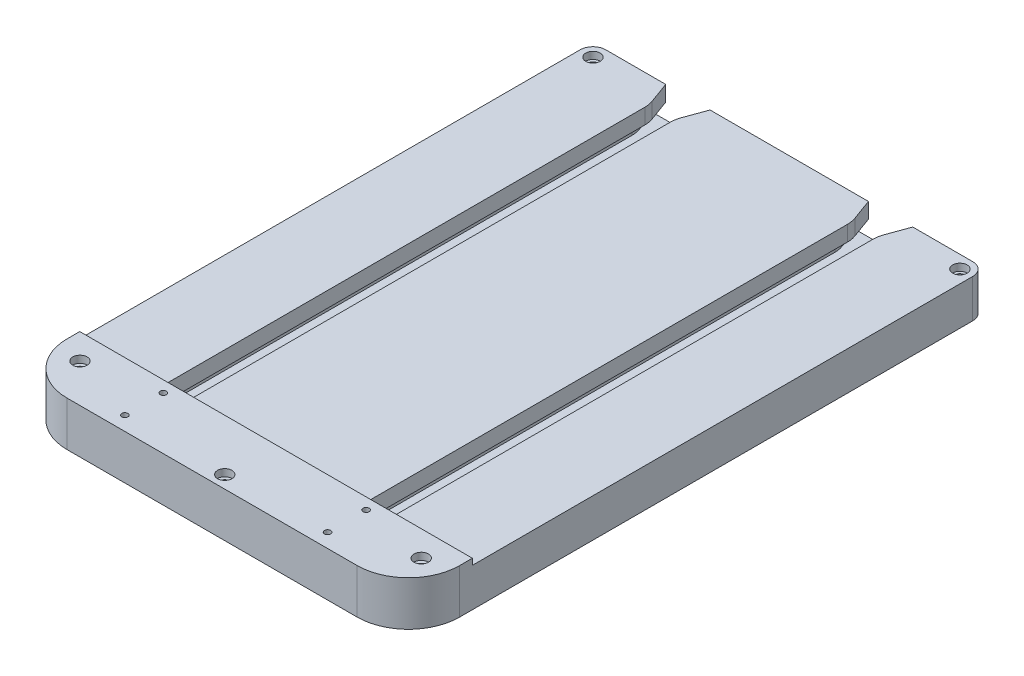
from build123d import *
from OCP.BRepFilletAPI import BRepFilletAPI_MakeChamfer

# Parameters (mm, degrees)
BOSS_EXTRUDE1_DEPTH                            = 254
SKETCH2_W                                      = 194.31
SKETCH2_H                                      = 44.45
SKETCH2_W_2                                    = 35.56
SKETCH2_H_2                                    = 17.018
BOSS_EXTRUDE2_DEPTH                            = 6.35
BOSS_EXTRUDE3_DEPTH                            = 44.45
CUT_EXTRUDE1_DEPTH                             = 324.390875065
CUT_EXTRUDE1_DEPTH_BACK                        = 324.390875065
SKETCH5_R                                      = 1.524
FILLET1_R                                      = 3.175
FILLET2_R                                      = 3.175
CBORE_FOR_6_SOCKET_HEAD_CAP_SCREW1_D           = 4.3053
CBORE_FOR_6_SOCKET_HEAD_CAP_SCREW1_CBORE_D     = 7.14502
CBORE_FOR_6_SOCKET_HEAD_CAP_SCREW1_CBORE_DEPTH = 3.5052
CHAMFER1_SIZE                                  = 12.7
CHAMFER1_SIZE2                                 = 4.622421975
FILLET4_R                                      = 12.7
FILLET6_R                                      = 6.35
FILLET7_R                                      = 2.54
CUT_EXTRUDE2_DEPTH                             = 363.564005121
SKETCH13_W                                     = 19.143193239
SKETCH13_H                                     = 43.092698141
CUT_EXTRUDE3_DEPTH                             = 362.835089653
FILLET8_R                                      = 25.4
CBORE_FOR_6_SOCKET_HEAD_CAP_SCREW3_D           = 3.6576
CBORE_FOR_6_SOCKET_HEAD_CAP_SCREW3_CBORE_D     = 7.14502
CBORE_FOR_6_SOCKET_HEAD_CAP_SCREW3_CBORE_DEPTH = 3.5052
CBORE_FOR_6_SOCKET_HEAD_CAP_SCREW4_D           = 3.6576
CBORE_FOR_6_SOCKET_HEAD_CAP_SCREW4_CBORE_D     = 7.14502
CBORE_FOR_6_SOCKET_HEAD_CAP_SCREW4_CBORE_DEPTH = 3.5052


with BuildPart() as part:
    # Sketch1 → Boss-Extrude1 (new body)
    with BuildSketch(Plane.XY):
        Polygon((-88.579180599, 2.764546242), (-47.939180599, 2.764546242), (-47.939180599, -4.855453758), (-54.289180599, -4.855453758), (-54.289180599, -12.475453758), (-28.889180599, -12.475453758), (-28.889180599, -4.855453758), (-35.239180599, -4.855453758), (-35.239180599, 2.764546242), (5.400819401, 2.764546242), (5.400819401, 28.164546242), (11.750819401, 28.164546242), (11.750819401, 2.764546242), (52.390819401, 2.764546242), (52.390819401, -4.855453758), (46.040819401, -4.855453758), (46.040819401, -12.475453758), (71.440819401, -12.475453758), (71.440819401, -4.855453758), (65.090819401, -4.855453758), (65.090819401, 2.764546242), (105.730819401, 2.764546242), (105.730819401, -16.285453758), (-88.579180599, -16.285453758), align=None)
    extrude(amount=BOSS_EXTRUDE1_DEPTH)

    # Sketch2 → Boss-Extrude2 (add)
    with BuildSketch(Plane.XY.offset(254)):
        with Locations((8.575819401, 5.939546242)):
            Rectangle(SKETCH2_W, SKETCH2_H)
        with Locations((-41.589180599, 14.321546242)):
            Rectangle(SKETCH2_W_2, SKETCH2_H_2, mode=Mode.SUBTRACT)
        with Locations((58.740819401, 14.321546242)):
            Rectangle(SKETCH2_W_2, SKETCH2_H_2, mode=Mode.SUBTRACT)
    extrude(amount=BOSS_EXTRUDE2_DEPTH)

    # Sketch3 → Boss-Extrude3 (add)
    with BuildSketch(Plane.XY.offset(260.35)):
        Polygon((-88.579180599, 5.812546242), (-88.579180599, -16.285453758), (105.730819401, -16.285453758), (105.730819401, 5.812546242), (76.520819401, 5.812546242), (40.960819401, 5.812546242), (-23.809180599, 5.812546242), (-59.369180599, 5.812546242), align=None)
    extrude(amount=BOSS_EXTRUDE3_DEPTH)

    # Sketch5 → Cut-Extrude1 (cut, two sides: drawn at the far end of the back side and taken through both)
    with BuildSketch(Plane(origin=(0, 5.812546242, 0), x_dir=(1, 0, 0), z_dir=(0, 1, 0)).offset(-CUT_EXTRUDE1_DEPTH_BACK)):
        with Locations(Location((-41.589180599, -259.614, 0), (0, 0, 180))):
            Circle(SKETCH5_R)
        with Locations(Location((-41.589180599, -278.664, 0), (0, 0, 180))):
            Circle(SKETCH5_R)
        with Locations(Location((58.740819401, -259.614, 0), (0, 0, 180))):
            Circle(SKETCH5_R)
        with Locations(Location((58.740819401, -278.664, 0), (0, 0, 180))):
            Circle(SKETCH5_R)
    extrude(amount=CUT_EXTRUDE1_DEPTH + CUT_EXTRUDE1_DEPTH_BACK, mode=Mode.SUBTRACT)

    # Fillet1
    # the kernel refuses this fillet: 3.175 mm, written as the material it takes off along each edge
    with BuildSketch(Plane(origin=(5.400819401, 28.164546242, -7.9375), x_dir=(0, -1, 0), z_dir=(0, 0, 1))) as fillet1_piece_1:
        with BuildLine():
            CenterArc((FILLET1_R, FILLET1_R), FILLET1_R, 180, 90)
            Line((0, FILLET1_R), (0, 0))
            Line((0, 0), (FILLET1_R, 0))
        make_face()
    extrude(amount=261.9375, mode=Mode.SUBTRACT)
    with BuildSketch(Plane(origin=(11.750819401, 28.164546242, -7.9375), x_dir=(0, -1, 0), z_dir=(0, 0, 1))) as fillet1_piece_2:
        with BuildLine():
            CenterArc((FILLET1_R, -FILLET1_R), FILLET1_R, 90, 90)
            Line((0, -FILLET1_R), (0, 0))
            Line((0, 0), (FILLET1_R, 0))
        make_face()
    extrude(amount=261.9375, mode=Mode.SUBTRACT)

    # Fillet2
    # the kernel refuses this fillet: 3.175 mm, written as the material it adds along each edge
    # the kernel refuses this fillet: 3.175 mm, written as the material it takes off along each edge
    with BuildSketch(Plane(origin=(65.343823241, 28.164546242, 260.35), x_dir=(0, -1, 0), z_dir=(-1, 0, 0))) as fillet2_2_piece_1:
        with BuildLine():
            CenterArc((FILLET2_R, -FILLET2_R), FILLET2_R, 90, 90)
            Line((0, -FILLET2_R), (0, 0))
            Line((0, 0), (FILLET2_R, 0))
        make_face()
    extrude(amount=113.536007681, mode=Mode.SUBTRACT)
    with BuildSketch(Plane(origin=(113.668319401, 28.164546242, 260.35), x_dir=(0, -1, 0), z_dir=(-1, 0, 0)), Plane(origin=(-34.986176759, 28.164546242, 260.35), x_dir=(0, -1, 0), z_dir=(-1, 0, 0))) as fillet2_2_piece_2:
        with BuildLine():
            CenterArc((FILLET2_R, -FILLET2_R), FILLET2_R, 90, 90)
            Line((0, -FILLET2_R), (0, 0))
            Line((0, 0), (FILLET2_R, 0))
        make_face()
    extrude(amount=61.53050384, mode=Mode.SUBTRACT)
    with BuildSketch(Plane(origin=(-96.516680599, 28.164546242, 254), x_dir=(0, -1, 0), z_dir=(1, 0, 0))) as fillet2_2_piece_3_section:
        with BuildLine():
            CenterArc((FILLET2_R, -FILLET2_R), FILLET2_R, 90, 90)
            Line((0, -FILLET2_R), (0, 0))
            Line((0, 0), (FILLET2_R, 0))
        make_face()
    fillet2_2_piece_3 = extrude(amount=105.0925, mode=Mode.PRIVATE)
    fillet2_2_piece_3 = fillet2_2_piece_3 - Plane(origin=(8.575819401, 24.989546242, 254.709193206), x_dir=(0, -1, 0), z_dir=(0, 0, -1)) * Cylinder(3.175, 223, mode=Mode.PRIVATE)
    add(fillet2_2_piece_3, mode=Mode.SUBTRACT)

    # CBORE for #6 Socket Head Cap Screw1 (through all)
    with Locations(Plane(origin=(0, 2.764546242, 0), x_dir=(1, 0, 0), z_dir=(0, 1, 0))):
        with Locations((99.380819401, -6.35), (-82.229180599, -6.35)):
            CounterBoreHole(CBORE_FOR_6_SOCKET_HEAD_CAP_SCREW1_D / 2, CBORE_FOR_6_SOCKET_HEAD_CAP_SCREW1_CBORE_D / 2, CBORE_FOR_6_SOCKET_HEAD_CAP_SCREW1_CBORE_DEPTH)

    # Chamfer1: one chamfer whose edges measure the first distance from different faces: ONE call of the kernel's chamfer builder (chamfer() names one face for all edges)
    chamfer1_edges_1 = [part.edges().sort_by_distance(p)[0] for p in [
        (-47.939180599, -1.045453758, 0),
    ]]
    chamfer1_side_1 = [part.faces().sort_by_distance(p)[0] for p in [
        (-47.939180599, -1.045453758, 127),
    ]]
    chamfer1_edges_2 = [part.edges().sort_by_distance(p)[0] for p in [
        (-54.289180599, -8.665453758, 0),
    ]]
    chamfer1_side_2 = [part.faces().sort_by_distance(p)[0] for p in [
        (-54.289180599, -8.665453758, 127),
    ]]
    chamfer1_edges_3 = [part.edges().sort_by_distance(p)[0] for p in [
        (-28.889180599, -8.665453758, 0),
    ]]
    chamfer1_side_3 = [part.faces().sort_by_distance(p)[0] for p in [
        (-28.889180599, -8.665453758, 127),
    ]]
    chamfer1_edges_4 = [part.edges().sort_by_distance(p)[0] for p in [
        (-35.239180599, -1.045453758, 0),
    ]]
    chamfer1_side_4 = [part.faces().sort_by_distance(p)[0] for p in [
        (-35.239180599, -1.045453758, 127),
    ]]
    chamfer1_edges_5 = [part.edges().sort_by_distance(p)[0] for p in [
        (52.390819401, -1.045453758, 0),
    ]]
    chamfer1_side_5 = [part.faces().sort_by_distance(p)[0] for p in [
        (52.390819401, -1.045453758, 127),
    ]]
    chamfer1_edges_6 = [part.edges().sort_by_distance(p)[0] for p in [
        (46.040819401, -8.665453758, 0),
    ]]
    chamfer1_side_6 = [part.faces().sort_by_distance(p)[0] for p in [
        (46.040819401, -8.665453758, 127),
    ]]
    chamfer1_edges_7 = [part.edges().sort_by_distance(p)[0] for p in [
        (71.440819401, -8.665453758, 0),
    ]]
    chamfer1_side_7 = [part.faces().sort_by_distance(p)[0] for p in [
        (71.440819401, -8.665453758, 127),
    ]]
    chamfer1_edges_8 = [part.edges().sort_by_distance(p)[0] for p in [
        (65.090819401, -1.045453758, 0),
    ]]
    chamfer1_side_8 = [part.faces().sort_by_distance(p)[0] for p in [
        (65.090819401, -1.045453758, 127),
    ]]
    chamfer1 = BRepFilletAPI_MakeChamfer(part.part.solid().wrapped)
    for e in chamfer1_edges_1:
        chamfer1.Add(CHAMFER1_SIZE, CHAMFER1_SIZE2, e.wrapped, chamfer1_side_1[0].wrapped)  # the first distance lies on this face
    for e in chamfer1_edges_2:
        chamfer1.Add(CHAMFER1_SIZE, CHAMFER1_SIZE2, e.wrapped, chamfer1_side_2[0].wrapped)  # the first distance lies on this face
    for e in chamfer1_edges_3:
        chamfer1.Add(CHAMFER1_SIZE, CHAMFER1_SIZE2, e.wrapped, chamfer1_side_3[0].wrapped)  # the first distance lies on this face
    for e in chamfer1_edges_4:
        chamfer1.Add(CHAMFER1_SIZE, CHAMFER1_SIZE2, e.wrapped, chamfer1_side_4[0].wrapped)  # the first distance lies on this face
    for e in chamfer1_edges_5:
        chamfer1.Add(CHAMFER1_SIZE, CHAMFER1_SIZE2, e.wrapped, chamfer1_side_5[0].wrapped)  # the first distance lies on this face
    for e in chamfer1_edges_6:
        chamfer1.Add(CHAMFER1_SIZE, CHAMFER1_SIZE2, e.wrapped, chamfer1_side_6[0].wrapped)  # the first distance lies on this face
    for e in chamfer1_edges_7:
        chamfer1.Add(CHAMFER1_SIZE, CHAMFER1_SIZE2, e.wrapped, chamfer1_side_7[0].wrapped)  # the first distance lies on this face
    for e in chamfer1_edges_8:
        chamfer1.Add(CHAMFER1_SIZE, CHAMFER1_SIZE2, e.wrapped, chamfer1_side_8[0].wrapped)  # the first distance lies on this face
    add(Compound.cast(chamfer1.Shape()), mode=Mode.REPLACE)

    # Fillet4
    fillet4_edges = [part.edges().sort_by_distance(p)[0] for p in [
        (-28.889180599, -8.665453758, 12.7),
        (-35.239180599, -1.045453758, 12.7),
        (-47.939180599, -1.045453758, 12.7),
        (-54.289180599, -8.665453758, 12.7),
        (52.390819401, -1.045453758, 12.7),
        (46.040819401, -8.665453758, 12.7),
        (71.440819401, -8.665453758, 12.7),
        (65.090819401, -1.045453758, 12.7),
    ]]
    fillet(fillet4_edges, radius=FILLET4_R)

    # Fillet6
    fillet6_edges = [part.edges().sort_by_distance(p)[0] for p in [
        (105.730819401, -6.760453758, 0),
        (-88.579180599, -6.760453758, 0),
    ]]
    fillet(fillet6_edges, radius=FILLET6_R)

    # Fillet7
    fillet7_edges = [part.edges().sort_by_distance(p)[0] for p in [
        (5.400819401, 13.877046242, 0),
        (8.575819401, 28.164546242, 0),
        (11.750819401, 13.877046242, 0),
    ]]
    fillet(fillet7_edges, radius=FILLET7_R)

    # Sketch8 → Cut-Extrude2 (cut, through all)
    with BuildSketch(Plane(origin=(105.730819401, 0, 0), x_dir=(0, 0, -1), z_dir=(1, 0, 0))):
        Polygon((-254, 2.764546242), (3.999834261, 2.764546242), (3.999834261, 41.93274121), (-234.463494025, 41.93274121), (-234.463494025, 51.374436441), (-260.35, 51.374436441), (-260.35, 5.812546242), (-254, 5.812546242), align=None)
    extrude(amount=-CUT_EXTRUDE2_DEPTH, mode=Mode.SUBTRACT)

    # Sketch13 → Cut-Extrude3 (cut, through all)
    with BuildSketch(Plane(origin=(105.730819401, 0, 0), x_dir=(0, 0, -1), z_dir=(1, 0, 0))):
        with Locations((-295.228403381, 5.260895312)):
            Rectangle(SKETCH13_W, SKETCH13_H)
    extrude(amount=-CUT_EXTRUDE3_DEPTH, mode=Mode.SUBTRACT)

    # Fillet8
    fillet8_edges = [part.edges().sort_by_distance(p)[0] for p in [
        (-88.579180599, -5.236453758, 285.656806761),
        (105.730819401, -5.236453758, 285.656806761),
    ]]
    fillet(fillet8_edges, radius=FILLET8_R)

    # CBORE for #6 Socket Head Cap Screw3 (through all)
    with Locations(Plane(origin=(0, 5.812546242, 0), x_dir=(1, 0, 0), z_dir=(0, 1, 0))):
        with Locations((8.575819401, -279.4)):
            CounterBoreHole(CBORE_FOR_6_SOCKET_HEAD_CAP_SCREW3_D / 2, CBORE_FOR_6_SOCKET_HEAD_CAP_SCREW3_CBORE_D / 2, CBORE_FOR_6_SOCKET_HEAD_CAP_SCREW3_CBORE_DEPTH)

    # CBORE for #6 Socket Head Cap Screw4 (through all)
    with Locations(Plane(origin=(0, 5.812546242, 0), x_dir=(1, 0, 0), z_dir=(0, 1, 0))):
        with Locations((93.030819401, -266.606806761), (-75.879180599, -266.606806761)):
            CounterBoreHole(CBORE_FOR_6_SOCKET_HEAD_CAP_SCREW4_D / 2, CBORE_FOR_6_SOCKET_HEAD_CAP_SCREW4_CBORE_D / 2, CBORE_FOR_6_SOCKET_HEAD_CAP_SCREW4_CBORE_DEPTH)


solid = part.part
